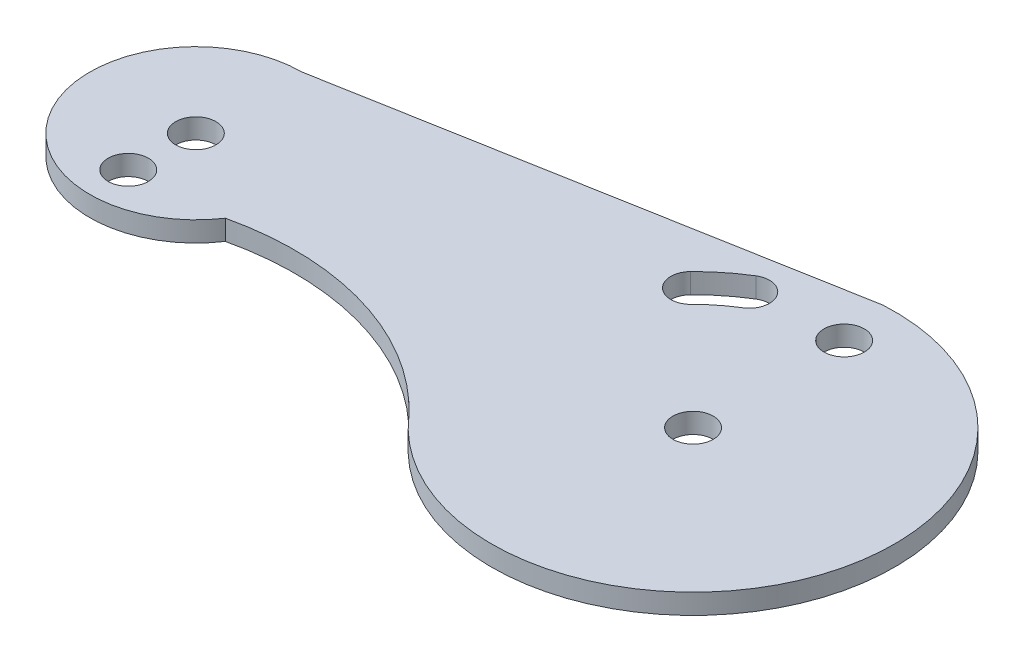
from build123d import *

# Parameters (mm, degrees)
SKETCH1_R           = 2
BOSS_EXTRUDE2_DEPTH = 2


with BuildPart() as part:
    # Sketch1 → Boss-Extrude2 (new body)
    with BuildSketch(Plane(origin=(0, 0, 0), x_dir=(1, 0, 0), z_dir=(0, 1, 0))):
        with BuildLine():
            Line((-33.676027055, 11.180582142), (15.211406628, 19.984204272))
            ThreePointArc((15.211406628, 19.984204272), (34.737966777, -7.78097648), (1.211790987, -13.090152535))
            ThreePointArc((1.211790987, -13.090152535), (-10.79582326, -5.653169844), (-24.912367612, -5.189826572))
            ThreePointArc((-24.912367612, -5.189826572), (-42.960314969, -4.320578887), (-33.676027055, 11.180582142))
        make_face()
        with Locations((-33.676027055, 0.649629179)):
            Circle(SKETCH1_R, mode=Mode.SUBTRACT)
        with Locations((-33.886225149, -5.846971221)):
            Circle(SKETCH1_R, mode=Mode.SUBTRACT)
        with Locations((16.319944597, 0.014949315)):
            Circle(SKETCH1_R, mode=Mode.SUBTRACT)
        with Locations((16.319944597, 15.014949315)):
            Circle(SKETCH1_R, mode=Mode.SUBTRACT)
        with BuildLine():
            ThreePointArc((8.470307193, 12.790626759), (9.126575205, 15.538418953), (6.378783011, 16.194686965))
            ThreePointArc((6.378783011, 16.194686965), (4.489608616, 14.869368007), (2.775143075, 13.324680936))
            ThreePointArc((2.775143075, 13.324680936), (2.799871291, 10.499714005), (5.624838222, 10.524442221))
            ThreePointArc((5.624838222, 10.524442221), (6.978596806, 11.744142082), (8.470307193, 12.790626759))
        make_face(mode=Mode.SUBTRACT)
    extrude(amount=BOSS_EXTRUDE2_DEPTH)


solid = part.part
